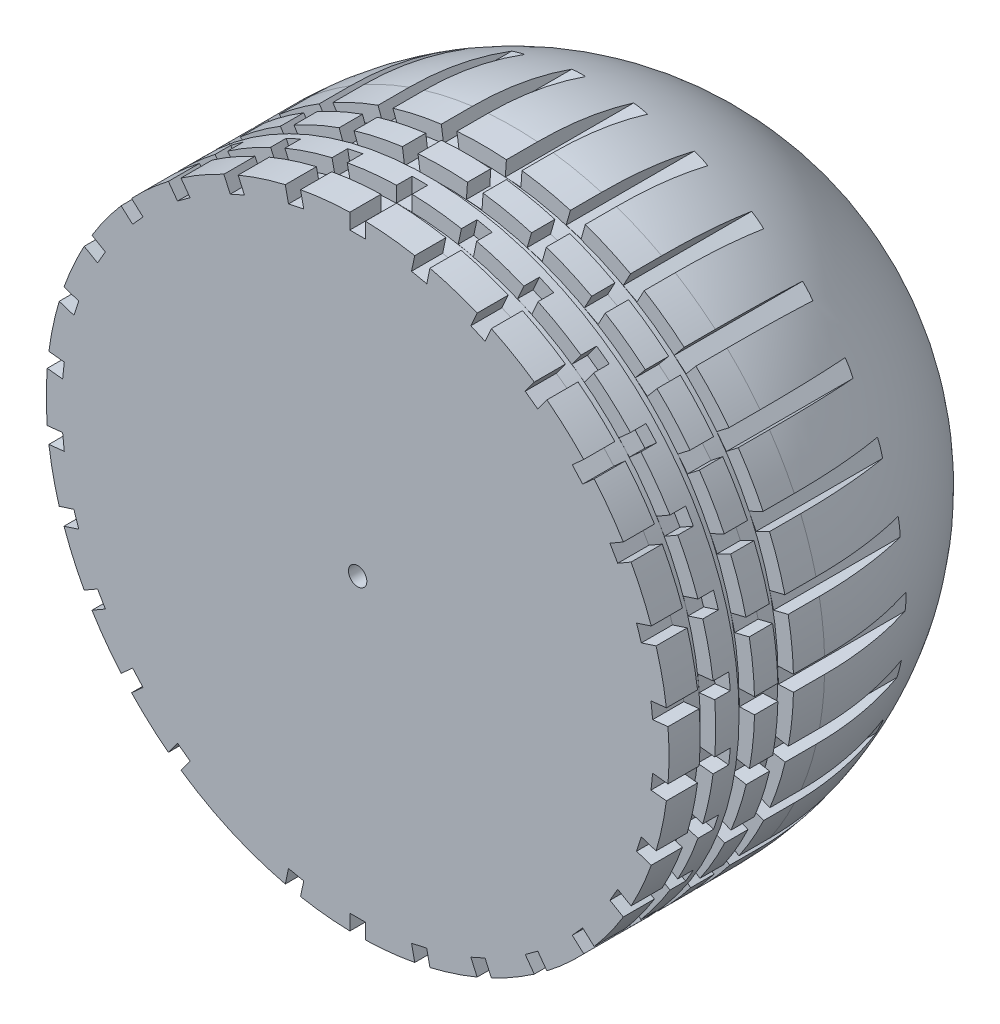
from build123d import *

# Parameters (mm, degrees)
SKETCH1_R           = 50.8
BOSS_EXTRUDE1_DEPTH = 25.4
SKETCH5_R           = 1.5
CUT_EXTRUDE1_DEPTH  = 50.8
SKETCH6_R           = 50.8
SKETCH6_R_2         = 48.26
CUT_EXTRUDE2_DEPTH  = 1.27
LPATTERN1_COUNT     = 2
LPATTERN1_PITCH     = 6.35
LPATTERN1_COL_COUNT = 2
LPATTERN1_COL_PITCH = 6.35
CUT_EXTRUDE4_START  = 12.7
SKETCH9_W           = 2.54
SKETCH9_H           = 2.54
CUT_EXTRUDE4_DEPTH  = 10.16
CUT_EXTRUDE5_DEPTH  = 50.8


# Read off the part's stored shape, not the designer's step: Revolve1
with BuildPart() as part:
    # Sketch1 → Boss-Extrude1 (new body)
    with BuildSketch(Plane.XY):
        Circle(SKETCH1_R)
    extrude(amount=BOSS_EXTRUDE1_DEPTH)

    # Revolve1 outline → Revolve1 (revolve)
    with BuildSketch(Plane.XZ):
        with BuildLine():
            Line((0, 5.1e-08), (0, -50.8))
            ThreePointArc((0, -50.8), (35.921024502, -35.921024466), (50.8, 5.1e-08))
            Line((50.8, 5.1e-08), (0, 5.1e-08))
        make_face()
    revolve(axis=Axis((0, 0, 0), (0, 0, 1)))

    # Sketch5 → Cut-Extrude1 (cut)
    with BuildSketch(Plane.XY.offset(25.4)):
        Circle(SKETCH5_R)
    extrude(amount=-CUT_EXTRUDE1_DEPTH, mode=Mode.SUBTRACT)

    # Sketch6 → Cut-Extrude2 (cut, symmetric)
    with BuildSketch(Plane.XY.offset(12.7)):
        Circle(SKETCH6_R)
        Circle(SKETCH6_R_2, mode=Mode.SUBTRACT)
    cut_extrude2 = extrude(amount=CUT_EXTRUDE2_DEPTH, both=True, mode=Mode.SUBTRACT)

    # LPattern1: Cut-Extrude2 ×2
    with Locations(*[(0, 0, i * LPATTERN1_PITCH) for i in range(1, LPATTERN1_COUNT)]):
        add(cut_extrude2, mode=Mode.SUBTRACT)

    # LPattern1 col: Cut-Extrude2 ×2
    with Locations(*[(0, 0, -i * LPATTERN1_COL_PITCH) for i in range(1, LPATTERN1_COL_COUNT)]):
        add(cut_extrude2, mode=Mode.SUBTRACT)

    # Sketch9 → Cut-Extrude4 (cut)
    with BuildSketch(Plane.XY.offset(12.7).offset(CUT_EXTRUDE4_START)):
        Polygon((11.804161346, 49.42585027), (11.276065652, 46.941355364), (8.791570746, 47.469451059), (9.319666441, 49.953945965), align=None)
        with Locations((0, 49.53)):
            Rectangle(SKETCH9_W, SKETCH9_H)
        Polygon((21.822424199, 45.891553712), (20.789313126, 43.571148249), (18.468907664, 44.604259323), (19.502018737, 46.924664785), align=None)
        Polygon((30.886942399, 40.351576044), (29.393967858, 38.296672878), (27.339064693, 39.789647419), (28.832039234, 41.844550585), align=None)
        Polygon((38.601553004, 33.048040875), (36.713965148, 31.348449135), (35.014373407, 33.236036991), (36.901961264, 34.935628731), align=None)
        Polygon((44.629090512, 24.300147737), (42.429385987, 23.030147737), (41.159385987, 25.229852263), (43.359090512, 26.499852263), align=None)
        Polygon((48.706122611, 14.490221539), (46.290439059, 13.705318373), (45.505535894, 16.121001924), (47.921219445, 16.90590509), align=None)
        Polygon((50.654463433, 4.047003127), (48.128377819, 3.78150083), (47.862875522, 6.307586444), (50.388961136, 6.573088741), align=None)
        Polygon((50.388961136, -6.573088741), (47.862875522, -6.307586444), (48.128377819, -3.78150083), (50.654463433, -4.047003127), align=None)
        Polygon((47.921219445, -16.90590509), (45.505535894, -16.121001924), (46.290439059, -13.705318373), (48.706122611, -14.490221539), align=None)
        Polygon((43.359090512, -26.499852263), (41.159385987, -25.229852263), (42.429385987, -23.030147737), (44.629090512, -24.300147737), align=None)
        Polygon((36.901961264, -34.935628731), (35.014373407, -33.236036991), (36.713965148, -31.348449135), (38.601553004, -33.048040875), align=None)
        Polygon((28.832039234, -41.844550585), (27.339064693, -39.789647419), (29.393967858, -38.296672878), (30.886942399, -40.351576044), align=None)
        Polygon((19.502018737, -46.924664785), (18.468907664, -44.604259323), (20.789313126, -43.571148249), (21.822424199, -45.891553712), align=None)
        Polygon((9.319666441, -49.953945965), (8.791570746, -47.469451059), (11.276065652, -46.941355364), (11.804161346, -49.42585027), align=None)
        with Locations((0, -49.53)):
            Rectangle(SKETCH9_W, SKETCH9_H)
        Polygon((-11.804161346, -49.42585027), (-11.276065652, -46.941355364), (-8.791570746, -47.469451059), (-9.319666441, -49.953945965), align=None)
        Polygon((-30.886942399, -40.351576044), (-29.393967858, -38.296672878), (-27.339064693, -39.789647419), (-28.832039234, -41.844550585), align=None)
        Polygon((-38.601553004, -33.048040875), (-36.713965148, -31.348449135), (-35.014373407, -33.236036991), (-36.901961264, -34.935628731), align=None)
        Polygon((-44.629090512, -24.300147737), (-42.429385987, -23.030147737), (-41.159385987, -25.229852263), (-43.359090512, -26.499852263), align=None)
        Polygon((-48.706122611, -14.490221539), (-46.290439059, -13.705318373), (-45.505535894, -16.121001924), (-47.921219445, -16.90590509), align=None)
        Polygon((-50.654463433, -4.047003127), (-48.128377819, -3.78150083), (-47.862875522, -6.307586444), (-50.388961136, -6.573088741), align=None)
        Polygon((-50.388961136, 6.573088741), (-47.862875522, 6.307586444), (-48.128377819, 3.78150083), (-50.654463433, 4.047003127), align=None)
        Polygon((-47.921219445, 16.90590509), (-45.505535894, 16.121001924), (-46.290439059, 13.705318373), (-48.706122611, 14.490221539), align=None)
        Polygon((-43.359090512, 26.499852263), (-41.159385987, 25.229852263), (-42.429385987, 23.030147737), (-44.629090512, 24.300147737), align=None)
        Polygon((-36.901961264, 34.935628731), (-35.014373407, 33.236036991), (-36.713965148, 31.348449135), (-38.601553004, 33.048040875), align=None)
        Polygon((-28.832039234, 41.844550585), (-27.339064693, 39.789647419), (-29.393967858, 38.296672878), (-30.886942399, 40.351576044), align=None)
        Polygon((-19.502018737, 46.924664785), (-18.468907664, 44.604259323), (-20.789313126, 43.571148249), (-21.822424199, 45.891553712), align=None)
        Polygon((-9.319666441, 49.953945965), (-8.791570746, 47.469451059), (-11.276065652, 46.941355364), (-11.804161346, 49.42585027), align=None)
    extrude(amount=-CUT_EXTRUDE4_DEPTH, mode=Mode.SUBTRACT)

    # Sketch11 → Cut-Extrude5 (cut)
    with BuildSketch(Plane.XY.offset(11.43)):
        Polygon((14.747441202, 49.949708232), (13.695813851, 46.27812086), (16.150908482, 45.574925103), (17.202535833, 49.246512475), align=None)
        Polygon((3.774765103, 48.1143527), (6.322412644, 47.936966333), (6.587693476, 51.746966333), (4.040045934, 51.9243527), align=None)
        Polygon((24.810302523, 45.792021829), (23.018289814, 42.419313071), (25.273532118, 41.221040952), (27.065544827, 44.593749711), align=None)
        Polygon((33.788834571, 39.633004338), (31.334756059, 36.70657775), (33.291581125, 35.065599511), (35.745659637, 37.9920261), align=None)
        Polygon((41.290632411, 31.741834377), (38.281743102, 29.389588844), (39.854628286, 27.377623109), (42.863517595, 29.729868642), align=None)
        Polygon((46.987831481, 22.463393939), (43.555634276, 20.788133878), (44.675836947, 18.493113204), (48.108034151, 20.168373265), align=None)
        Polygon((50.631436842, 12.203195395), (46.92593523, 11.27813771), (47.544497155, 8.800365512), (51.249998768, 9.725423197), align=None)
        Polygon((52.062205456, 1.409658654), (48.245347637, 1.275232805), (48.335234694, -1.277000382), (52.152092513, -1.142574532), align=None)
        Polygon((51.21760587, -9.445486934), (47.456206847, -8.783405893), (47.013490538, -11.298555231), (50.774889562, -11.960636271), align=None)
        Polygon((48.134551139, -19.887819418), (44.593002097, -18.458167606), (43.63703125, -20.826309), (47.178580292, -22.255960812), align=None)
        Polygon((42.947785547, -29.460958762), (39.780869174, -27.326218822), (38.353424303, -29.44385313), (41.520340676, -31.578593069), align=None)
        Polygon((35.88399564, -37.746512838), (33.230121379, -34.99998315), (31.393588674, -36.774559591), (34.047462935, -39.521089278), align=None)
        Polygon((27.251902933, -44.382363175), (25.227057823, -41.144080266), (23.061702576, -42.498041334), (25.086547686, -45.736324243), align=None)
        Polygon((17.4287713, -49.078491272), (16.121450788, -45.489983643), (13.721909413, -46.364154742), (15.029229925, -49.952662371), align=None)
        Polygon((6.843918727, -51.629653795), (6.311258994, -47.84775645), (3.782402964, -48.203932108), (4.315062698, -51.985829453), align=None)
        Polygon((-4.040045934, -51.9243527), (-3.774765103, -48.1143527), (-6.322412644, -47.936966333), (-6.587693476, -51.746966333), align=None)
        Polygon((-14.747441202, -49.949708232), (-13.695813851, -46.27812086), (-16.150908482, -45.574925103), (-17.202535833, -49.246512475), align=None)
        Polygon((-24.810302523, -45.792021829), (-23.018289814, -42.419313071), (-25.273532118, -41.221040952), (-27.065544827, -44.593749711), align=None)
        Polygon((-33.788834571, -39.633004338), (-31.334756059, -36.70657775), (-33.291581125, -35.065599511), (-35.745659637, -37.9920261), align=None)
        Polygon((-41.290632411, -31.741834377), (-38.281743102, -29.389588844), (-39.854628286, -27.377623109), (-42.863517595, -29.729868642), align=None)
        Polygon((-46.987831481, -22.463393939), (-43.555634276, -20.788133878), (-44.675836947, -18.493113204), (-48.108034151, -20.168373265), align=None)
        Polygon((-50.631436842, -12.203195395), (-46.92593523, -11.27813771), (-47.544497155, -8.800365512), (-51.249998768, -9.725423197), align=None)
        Polygon((-52.062205456, -1.409658654), (-48.245347637, -1.275232805), (-48.335234694, 1.277000382), (-52.152092513, 1.142574532), align=None)
        Polygon((-51.21760587, 9.445486934), (-47.456206847, 8.783405893), (-47.013490538, 11.298555231), (-50.774889562, 11.960636271), align=None)
        Polygon((-48.134551139, 19.887819418), (-44.593002097, 18.458167606), (-43.63703125, 20.826309), (-47.178580292, 22.255960812), align=None)
        Polygon((-42.947785547, 29.460958762), (-39.780869174, 27.326218822), (-38.353424303, 29.44385313), (-41.520340676, 31.578593069), align=None)
        Polygon((-35.88399564, 37.746512838), (-33.230121379, 34.99998315), (-31.393588674, 36.774559591), (-34.047462935, 39.521089278), align=None)
        Polygon((-27.251902933, 44.382363175), (-25.227057823, 41.144080266), (-23.061702576, 42.498041334), (-25.086547686, 45.736324243), align=None)
        Polygon((-17.4287713, 49.078491272), (-16.121450788, 45.489983643), (-13.721909413, 46.364154742), (-15.029229925, 49.952662371), align=None)
        Polygon((-6.843918727, 51.629653795), (-6.311258994, 47.84775645), (-3.782402964, 48.203932108), (-4.315062698, 51.985829453), align=None)
    extrude(amount=-CUT_EXTRUDE5_DEPTH, mode=Mode.SUBTRACT)


solid = part.part
